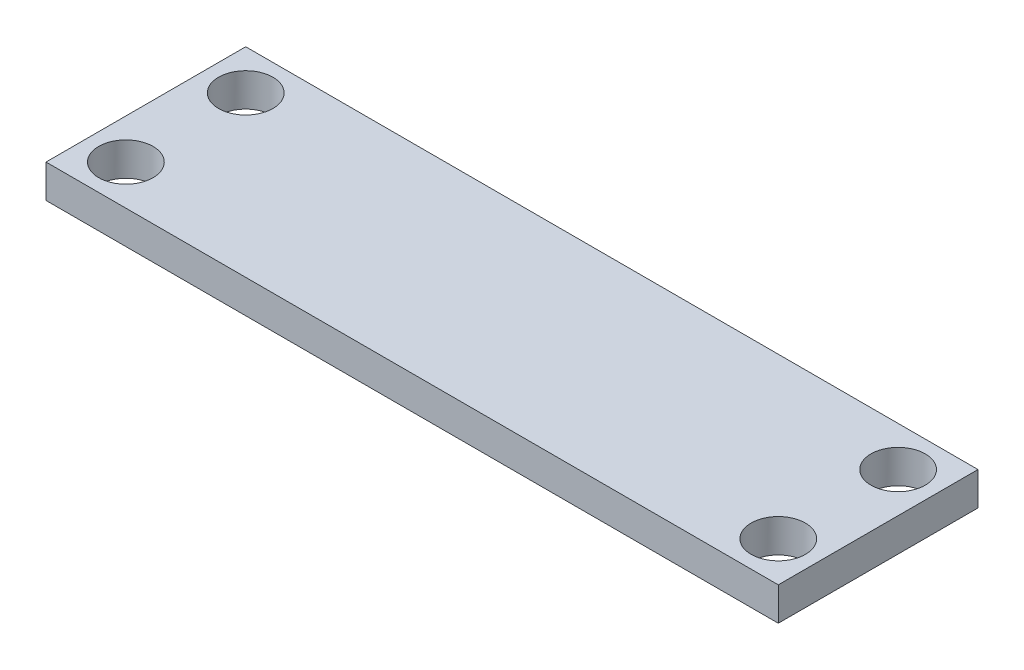
from build123d import *

# Parameters (mm, degrees)
SKETCH1_W                          = 69.85
SKETCH1_H                          = 19.05
BOSS_EXTRUDE1_DEPTH                = 1.5875
F_6_START                          = -1.5875
F_6_0_204_DIAMETER_HOLE1_OUTLINE_R = 2.5908
F_6_0_204_DIAMETER_HOLE1_DEPTH     = 3.175


# Read off the part's stored shape, not the designer's step: #6 (0.204) Diameter Hole1
with BuildPart() as part:
    # Sketch1 → Boss-Extrude1 (new, symmetric)
    with BuildSketch(Plane(origin=(0, 0, 0), x_dir=(1, 0, 0), z_dir=(0, 1, 0))):
        Rectangle(SKETCH1_W, SKETCH1_H)
    extrude(amount=BOSS_EXTRUDE1_DEPTH, both=True)

    # #6 (0.204) Diameter Hole1 outline → #6 (0.204) Diameter Hole1 (cut)
    with BuildSketch(Plane(origin=(0, 0, 0), x_dir=(1, 0, 0), z_dir=(0, 1, 0)).offset(F_6_START)):
        with Locations((-31.115, -5.715)):
            Circle(F_6_0_204_DIAMETER_HOLE1_OUTLINE_R)
        with Locations((31.115, 5.715)):
            Circle(F_6_0_204_DIAMETER_HOLE1_OUTLINE_R)
        with Locations((31.115, -5.715)):
            Circle(F_6_0_204_DIAMETER_HOLE1_OUTLINE_R)
        with Locations((-31.115, 5.715)):
            Circle(F_6_0_204_DIAMETER_HOLE1_OUTLINE_R)
    extrude(amount=F_6_0_204_DIAMETER_HOLE1_DEPTH, mode=Mode.SUBTRACT)


solid = part.part
